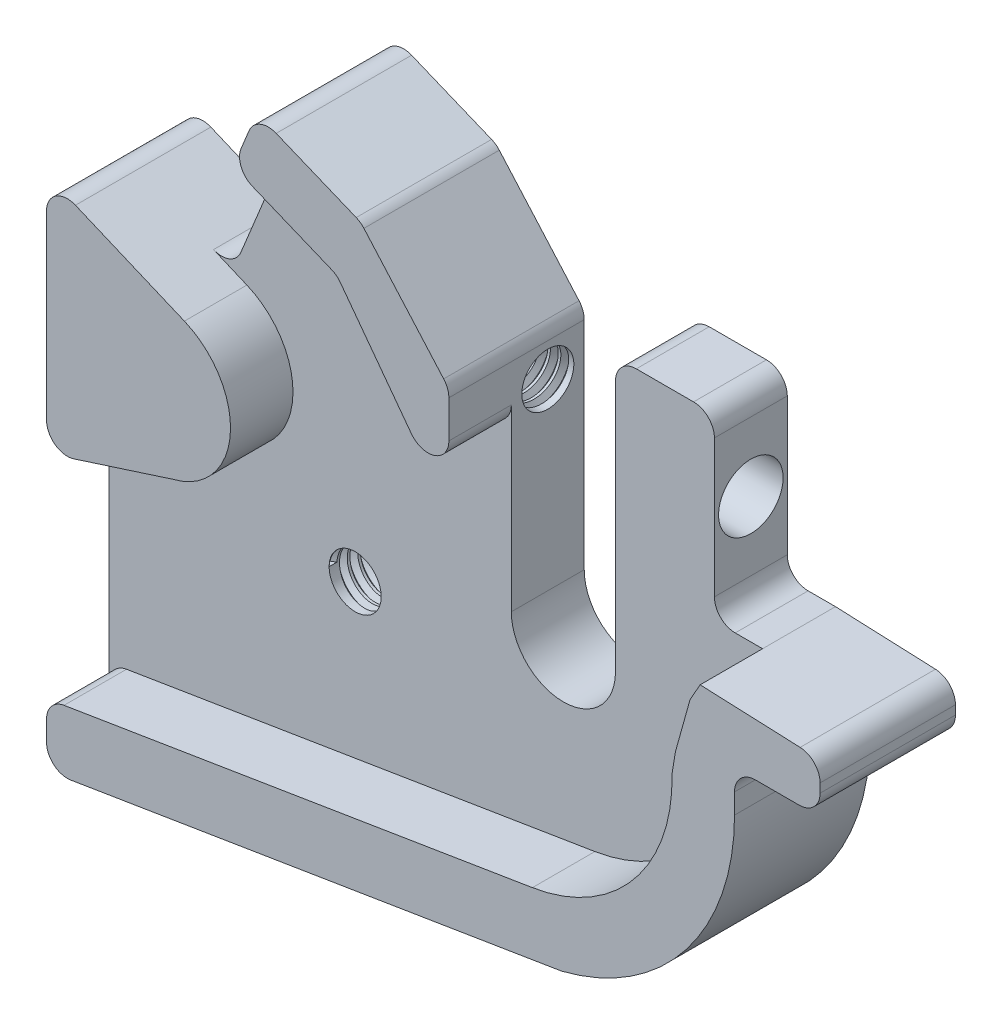
from build123d import *

# Parameters (mm, degrees)
BOSS_EXTRUDE2_DEPTH             = 7
BOSS_EXTRUDE3_DEPTH             = 13
TAP_DRILL_FOR_M6X1_0_TAP3_D     = 5
TAP_DRILL_FOR_M6X1_0_TAP3_DEPTH = 43
TAP_DRILL_FOR_M6X1_0_TAP3_TIP   = 1.5021515475689007
FILLET1_R                       = 2
TAP_DRILL_FOR_M6X1_0_TAP2_D     = 5
THREAD1_PITCH                   = 1
SKETCH2_R                       = 3.0999999999999983
CUT_EXTRUDE2_DEPTH              = 9.999999999999996
THREAD2_PITCH                   = 1


with BuildPart() as part:
    # Sketch1 → Boss-Extrude2 (new body)
    with BuildSketch(Plane.XY):
        with BuildLine():
            Line((23.224596799831595, 11.838054320739976), (18.594616956763275, 11.838054320739976))
            Line((18.594616956763275, 11.838054320739976), (18.594616956763275, 29.0520343287084))
            Line((18.594616956763275, 29.052034328708398), (9.094616956763277, 29.052034328708398))
            Line((9.094616956763277, 29.052034328708398), (9.094616956763272, 2.8469015838410883))
            ThreePointArc((9.094616956763272, 2.846901583841089), (4.094616956762875, -2.153098416158908), (-0.9053830432367223, 2.846901583841888))
            Line((-0.905383043236724, 2.8469015838418885), (-0.9053830432367259, 24.399326740540857))
            Line((-0.9053830432367259, 24.399326740540857), (-9.372834944506629, 34.00764813303465))
            Line((-9.372834944506627, 34.00764813303465), (-19.338054555793107, 38.10430027910595))
            Line((-19.338054555793107, 38.10430027910595), (-27.64949584669558, 17.88648954074799))
            Line((-27.64949584669558, 17.886489540747988), (-39.54243331524863, 22.895355765149752))
            Line((-39.54243331524863, 22.895355765149752), (-39.54243331524862, -26.68595837588142))
            Line((-39.54243331524862, -26.68595837588142), (9.930508904802714, -18.62730077710855))
            ThreePointArc((9.93050890480271, -18.62730077710854), (21.888607340272777, -10.842166970276775), (26.528997575110665, 2.651209369657105))
            Line((26.528997575110658, 2.6512093696571015), (26.528997575110658, 6.583034036121315))
            Line((26.528997575110658, 6.583034036121315), (34.74430312273597, 6.583034036121314))
            Line((34.74430312273597, 6.583034036121314), (34.74430312273597, 11.35464156582886))
            Line((34.74430312273597, 11.35464156582886), (23.22459679983159, 11.838054320739976))
        make_face()
    extrude(amount=BOSS_EXTRUDE2_DEPTH)

    # Sketch1<7> → Boss-Extrude3 (add)
    with BuildSketch(Plane.XY):
        Polygon((-0.9053830432367259, 14.019993611037982), (-0.9053830432367259, 24.399326740540857), (-9.372834944506629, 34.00764813303465), (-19.338054555793107, 38.10430027910595), (-21.61937542853537, 32.55492418123779), (-11.654155817248892, 28.458272035166488), align=None)
        with BuildLine():
            Line((20.85012579434564, 5.080010210629205), (20.52330351237285, 3.0772079508363284))
            ThreePointArc((20.523303512372856, 3.0772079508363284), (16.858734444980243, -7.523493754122956), (7.118615678125689, -13.085330635476565))
            Line((7.118615678125689, -13.085330635476566), (-39.542433315248616, -20.685958375881416))
            Line((-39.54243331524862, -20.685958375881416), (-39.54243331524862, -26.68595837588142))
            Line((-39.54243331524862, -26.68595837588142), (9.930508904802714, -18.62730077710855))
            ThreePointArc((9.93050890480271, -18.62730077710854), (21.888607340272777, -10.842166970276775), (26.528997575110665, 2.651209369657105))
            Line((26.528997575110658, 2.6512093696571015), (26.528997575110658, 6.583034036121315))
            Line((26.528997575110658, 6.583034036121315), (34.74430312273597, 6.583034036121314))
            Line((34.74430312273597, 6.583034036121314), (34.74430312273597, 11.35464156582886))
            Line((34.74430312273597, 11.35464156582886), (23.22459679983159, 11.838054320739976))
            Line((23.224596799831595, 11.838054320739976), (22.25718626662765, 10.122973627008314))
            Line((22.25718626662765, 10.122973627008314), (20.85012579434564, 5.080010210629205))
        make_face()
        with BuildLine():
            Line((-26.30362524162322, 17.319658525787453), (-39.54243331524863, 22.895355765149752))
            Line((-39.54243331524863, 22.895355765149752), (-39.54243331524863, -0.28742000905455))
            Line((-39.54243331524863, -0.28742000905455056), (-27.37216227343774, 3.626296889654118))
            ThreePointArc((-27.372162273437734, 3.6262968896540997), (-21.8978313295958, 10.087488754460773), (-26.30362524162322, 17.319658525787453))
        make_face()
    extrude(amount=BOSS_EXTRUDE3_DEPTH)

    # Tap Drill for M6x1.0 Tap3
    with Locations(Plane(origin=(18.594616957, 20.445044325, 3.5), x_dir=(0, 0, 1), z_dir=(1, 0, 0))):
        with Locations((0, 0)):
            Hole(TAP_DRILL_FOR_M6X1_0_TAP3_D / 2, depth=TAP_DRILL_FOR_M6X1_0_TAP3_DEPTH)
            with Locations((0, 0, -(TAP_DRILL_FOR_M6X1_0_TAP3_DEPTH + TAP_DRILL_FOR_M6X1_0_TAP3_TIP / 2))):  # 118° drill point
                Cone(0, TAP_DRILL_FOR_M6X1_0_TAP3_D / 2, TAP_DRILL_FOR_M6X1_0_TAP3_TIP, mode=Mode.SUBTRACT)

    # Fillet1
    fillet1_edges = [part.edges().sort_by_distance(p)[0] for p in [
        (-21.61937542853537, 32.55492418123779, 10),
        (-11.654155817248892, 28.458272035166488, 10),
        (-0.9053830432367262, 14.019993611037982, 10),
        (-39.54243331524863, -0.2874200090545503, 10),
        (9.094616956763277, 29.052034328708398, 3.5),
        (18.594616956763275, 29.0520343287084, 3.5),
        (18.594616956763275, 11.838054320739976, 3.5),
        (34.74430312273597, 11.35464156582886, 6.5),
        (34.74430312273597, 6.583034036121314, 6.5),
        (26.528997575110658, 6.583034036121315, 6.5),
        (-39.54243331524862, -26.68595837588142, 6.5),
        (-39.54243331524863, 22.895355765149752, 6.5),
        (-27.64949584669558, 17.886489540747988, 3.5),
        (-19.338054555793107, 38.10430027910595, 6.5),
        (-9.372834944506629, 34.00764813303465, 6.5),
        (-0.9053830432367259, 24.399326740540857, 6.5),
        (-39.542433315248616, -20.685958375881416, 10),
    ]]
    fillet(fillet1_edges, radius=FILLET1_R)

    # Tap Drill for M6x1.0 Tap2 (through all)
    with Locations(Plane(origin=(-15.905383043, -2.153098416, 7), x_dir=(1, 0, 0), z_dir=(0, 0, 1))):
        with Locations((0, 0)):
            Hole(TAP_DRILL_FOR_M6X1_0_TAP2_D / 2)

    # Thread1: arcs per turn and ends read off the stored shape
    # Thread1: the profile of Thread Profile2 profile screwed along a right-hand helix through 23 turns, 8 arcs to a turn; built about Z, then put on its axis
    thread1_z = Axis((0, 0, 0), (0, 0, 1))
    thread1_corners = [(2.4997, 0, -0.000173205), (3.041265875, 0, 0.312499999), (3.041265875, 0, 0.437499999), (2.4997, 0, 0.750173203)]
    with BuildLine(mode=Mode.PRIVATE) as thread1_profile:
        Line(thread1_corners[0], thread1_corners[1])
        Line(thread1_corners[1], thread1_corners[2])
        Line(thread1_corners[2], thread1_corners[3])
        Line(thread1_corners[3], thread1_corners[0])
    thread1_cap = Face(thread1_profile.wire())
    thread1_turn_angles = [0, 22.5, 45, 67.5, 90, 112.5, 135, 157.5, 180, 202.5, 225, 247.5, 270, 292.5, 315, 337.5, 360]
    thread1_turn_weights = [1, 0.9238795325112867, 1, 0.9238795325112867, 1, 0.9238795325112867, 1, 0.9238795325112867, 1, 0.9238795325112867, 1, 0.9238795325112867, 1, 0.9238795325112867, 1, 0.9238795325112867, 1]
    thread1_turn_rails = [Edge.make_bspline([Vector(p[0], p[1], 0).rotate(thread1_z, thread1_turn_angles[k]) / thread1_turn_weights[k] + Vector(0, 0, p[2] + THREAD1_PITCH * thread1_turn_angles[k] / 360) for k in range(17)], [0, 0, 0, 1, 1, 2, 2, 3, 3, 4, 4, 5, 5, 6, 6, 7, 7, 8, 8, 8], 2, thread1_turn_weights) for p in thread1_corners]
    thread1_turn_sides = [Face.make_surface_from_curves(thread1_turn_rails[p[0]], thread1_turn_rails[p[1]]) for p in [(0, 1), (1, 2), (2, 3), (3, 0)]]
    thread1 = Plane(origin=(-0.905383043, 20.445044325, 3.5), x_dir=(0, 0, 1), z_dir=(-1, 0, 0)) * Solid(Shell([*[p.moved(Location((0, 0, THREAD1_PITCH * i))) for i in range(23) for p in thread1_turn_sides], thread1_cap, thread1_cap.rotate(thread1_z, 8280).moved(Location((0, 0, THREAD1_PITCH * 8280 / 360)))]))
    add(thread1, mode=Mode.SUBTRACT)

    # Sketch2 → Cut-Extrude2 (cut)
    with BuildSketch(Plane(origin=(18.594616956763275, 0, 0), x_dir=(0, 0, -1), z_dir=(1, 0, 0))):
        with Locations((-3.499999999999999, 20.445044324724186)):
            Circle(SKETCH2_R)
    extrude(amount=-CUT_EXTRUDE2_DEPTH, mode=Mode.SUBTRACT)

    # Thread2: arcs per turn and ends read off the stored shape
    # Thread2: the profile of Thread Profile3 profile screwed along a right-hand helix through 13 turns, 8 arcs to a turn; built about Z, then put on its axis
    thread2_z = Axis((0, 0, 0), (0, 0, 1))
    thread2_corners = [(2.4997, 0, -0.000173205), (3.041265875, 0, 0.312499999), (3.041265875, 0, 0.437499999), (2.4997, 0, 0.750173202)]
    with BuildLine(mode=Mode.PRIVATE) as thread2_profile:
        Line(thread2_corners[0], thread2_corners[1])
        Line(thread2_corners[1], thread2_corners[2])
        Line(thread2_corners[2], thread2_corners[3])
        Line(thread2_corners[3], thread2_corners[0])
    thread2_cap = Face(thread2_profile.wire())
    thread2_turn_angles = [0, 22.5, 45, 67.5, 90, 112.5, 135, 157.5, 180, 202.5, 225, 247.5, 270, 292.5, 315, 337.5, 360]
    thread2_turn_weights = [1, 0.9238795325112867, 1, 0.9238795325112867, 1, 0.9238795325112867, 1, 0.9238795325112867, 1, 0.9238795325112867, 1, 0.9238795325112867, 1, 0.9238795325112867, 1, 0.9238795325112867, 1]
    thread2_turn_rails = [Edge.make_bspline([Vector(p[0], p[1], 0).rotate(thread2_z, thread2_turn_angles[k]) / thread2_turn_weights[k] + Vector(0, 0, p[2] + THREAD2_PITCH * thread2_turn_angles[k] / 360) for k in range(17)], [0, 0, 0, 1, 1, 2, 2, 3, 3, 4, 4, 5, 5, 6, 6, 7, 7, 8, 8, 8], 2, thread2_turn_weights) for p in thread2_corners]
    thread2_turn_sides = [Face.make_surface_from_curves(thread2_turn_rails[p[0]], thread2_turn_rails[p[1]]) for p in [(0, 1), (1, 2), (2, 3), (3, 0)]]
    thread2 = Plane(origin=(-15.905383043, -2.153098416, 7), x_dir=(-1, 0, 0), z_dir=(0, 0, -1)) * Solid(Shell([*[p.moved(Location((0, 0, THREAD2_PITCH * i))) for i in range(13) for p in thread2_turn_sides], thread2_cap, thread2_cap.rotate(thread2_z, 4680).moved(Location((0, 0, THREAD2_PITCH * 4680 / 360)))]))
    add(thread2, mode=Mode.SUBTRACT)


solid = part.part
